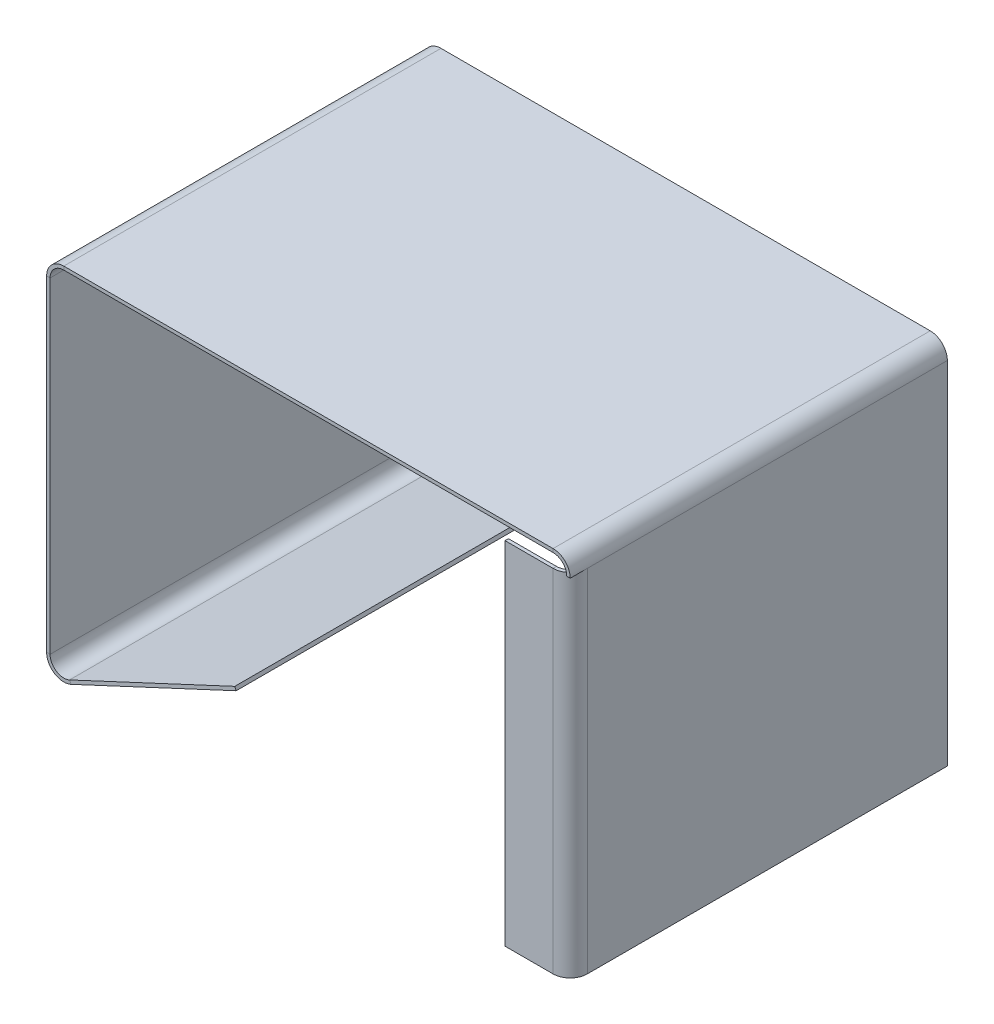
from build123d import *

# Parameters (mm, degrees)
BASE_FLANGE1_DEPTH           = 110
EDGE_FLANGE1_DEPTH           = 110
EDGE_FLANGE1_2_DEPTH         = 110
EDGE_FLANGE2_STRIP_W         = 12
EDGE_FLANGE2_STRIP_H         = 1
EDGE_FLANGE2_STRIP_CUT_DEPTH = 102.437324841
EDGE_FLANGE2_DEPTH           = 102.437324841


# Read off the part's stored shape, not the designer's step: Edge-Flange1
# Sheet-metal steps are written as plain solids
with BuildPart() as part:
    # Sketch1 → Base-Flange1 (new body)
    with BuildSketch(Plane.XY):
        with BuildLine():
            Line((75.34839628, -53.21866242), (75.34839628, 49.21866242))
            ThreePointArc((75.34839628, 49.21866242), (74.176823405, 52.047089545), (71.34839628, 53.21866242))
            Line((71.34839628, 53.21866242), (-71.34839628, 53.21866242))
            ThreePointArc((-71.34839628, 53.21866242), (-74.176823405, 52.047089545), (-75.34839628, 49.21866242))
            Line((-75.34839628, 49.21866242), (-75.34839628, -53.21866242))
            Line((-75.34839628, -53.21866242), (-76.34839628, -53.21866242))
            Line((-76.34839628, -53.21866242), (-76.34839628, 49.21866242))
            ThreePointArc((-76.34839628, 49.21866242), (-74.883930186, 52.754196326), (-71.34839628, 54.21866242))
            Line((-71.34839628, 54.21866242), (71.34839628, 54.21866242))
            ThreePointArc((71.34839628, 54.21866242), (74.883930186, 52.754196326), (76.34839628, 49.21866242))
            Line((76.34839628, 49.21866242), (76.34839628, -53.21866242))
            Line((76.34839628, -53.21866242), (75.34839628, -53.21866242))
        make_face()
    extrude(amount=BASE_FLANGE1_DEPTH)

    # Edge-Flange1 outline → Edge-Flange1 (cut)
    with BuildSketch(Plane.XY):
        with BuildLine():
            Line((-75.34839628, -53.21866242), (-75.34839628, -48.836542193))
            ThreePointArc((-75.34839628, -48.836542193), (-76.09181277, -47.417681023), (-76.34839628, -45.836542193))
            Line((-76.34839628, -45.836542193), (-76.34839628, -53.21866242))
            Line((-76.34839628, -53.21866242), (-75.34839628, -53.21866242))
        make_face()
    extrude(amount=EDGE_FLANGE1_DEPTH, mode=Mode.SUBTRACT)

    # Edge-Flange1 2 outline → Edge-Flange1 2 (add)
    with BuildSketch(Plane.XY):
        with BuildLine():
            ThreePointArc((-75.34839628, -48.836542193), (-72.563513138, -50.686644359), (-69.235304971, -50.368081128))
            Line((-69.235304971, -50.368081128), (-21.063621271, -27.905256112))
            Line((-21.063621271, -27.905256112), (-21.486239533, -26.998948325))
            Line((-21.486239533, -26.998948325), (-69.657923233, -49.461773341))
            ThreePointArc((-69.657923233, -49.461773341), (-73.497594713, -49.210107976), (-75.34839628, -45.836542193))
            Line((-75.34839628, -45.836542193), (-75.34839628, -48.836542193))
        make_face()
    extrude(amount=EDGE_FLANGE1_2_DEPTH)

    # Edge-Flange2 strip (across the edge) → Edge-Flange2 strip cut (cut)
    with BuildSketch(Plane(origin=(75.34839628, -53.21866242, 110), x_dir=(0, 0, -1), z_dir=(0, 1, 0))):
        with Locations((-1, -0.5)):
            Rectangle(EDGE_FLANGE2_STRIP_W, EDGE_FLANGE2_STRIP_H)
    extrude(amount=EDGE_FLANGE2_STRIP_CUT_DEPTH, mode=Mode.SUBTRACT)

    # Edge-Flange2 section (across the edge) → Edge-Flange2 (add)
    with BuildSketch(Plane(origin=(75.34839628, -53.21866242, 110), x_dir=(0, 0, -1), z_dir=(0, 1, 0))):
        with BuildLine():
            Line((0, 4), (0, 18))
            Line((0, 18), (1, 18))
            Line((1, 18), (1, 4))
            ThreePointArc((1, 4), (2.171572875, 1.171572875), (5, 0))
            Line((5, 0), (5, -1))
            ThreePointArc((5, -1), (1.464466094, 0.464466094), (0, 4))
        make_face()
    extrude(amount=EDGE_FLANGE2_DEPTH)


solid = part.part
